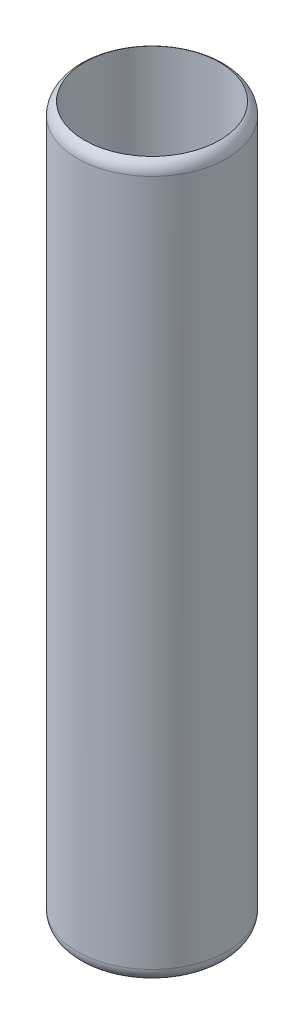
from build123d import *

# Parameters (mm, degrees)
SKETCH1_R           = 5.25
BOSS_EXTRUDE1_DEPTH = 50
SKETCH2_R           = 4.75
CUT_EXTRUDE1_DEPTH  = 50
FILLET1_R           = 1


with BuildPart() as part:
    # Sketch1 → Boss-Extrude1 (new body)
    with BuildSketch(Plane(origin=(0, 0, 0), x_dir=(1, 0, 0), z_dir=(0, 1, 0))):
        with Locations(Location((0, 0, 0), (0, 0, 270))):
            Circle(SKETCH1_R)
    extrude(amount=BOSS_EXTRUDE1_DEPTH)

    # Sketch2 → Cut-Extrude1 (cut)
    with BuildSketch(Plane(origin=(0, 50, 0), x_dir=(1, 0, 0), z_dir=(0, 1, 0))):
        with Locations(Location((0, 0, 0), (0, 0, 270))):
            Circle(SKETCH2_R)
    extrude(amount=-CUT_EXTRUDE1_DEPTH, mode=Mode.SUBTRACT)

    # Fillet1
    # the kernel refuses this fillet: 1 mm, written as the material it takes off along each edge
    with BuildSketch(Plane(origin=(0, 0, 0), x_dir=(0, 0, 1), z_dir=(-1, 0, 0))) as fillet1_piece_1:
        with BuildLine():
            CenterArc((4.25, 0.866025404), FILLET1_R, 300, 60)
            Line((4.75, 0), (4.76, -0.017320508))
            ThreePointArc((4.76, -0.017320508), (5, -0.02), (5.25, -0.02))
            Line((5.25, -0.02), (5.27, 0))
            Line((5.27, 0), (5.27, 0.866025404))
            Line((5.27, 0.866025404), (5.25, 0.866025404))
        make_face()
    revolve(axis=Axis((0, 0, 0), (0, 1, 0)), mode=Mode.SUBTRACT)
    with BuildSketch(Plane(origin=(0, 50, 0), x_dir=(0, 0, 1), z_dir=(-1, 0, 0))) as fillet1_piece_2:
        with BuildLine():
            CenterArc((4.25, -0.866025404), FILLET1_R, 0, 60)
            Line((4.75, 0), (4.76, 0.017320508))
            ThreePointArc((4.76, 0.017320508), (5, 0.02), (5.25, 0.02))
            Line((5.25, 0.02), (5.27, 0))
            Line((5.27, 0), (5.27, -0.866025404))
            Line((5.27, -0.866025404), (5.25, -0.866025404))
        make_face()
    revolve(axis=Axis((0, 50, 0), (0, 1, 0)), mode=Mode.SUBTRACT)


solid = part.part
